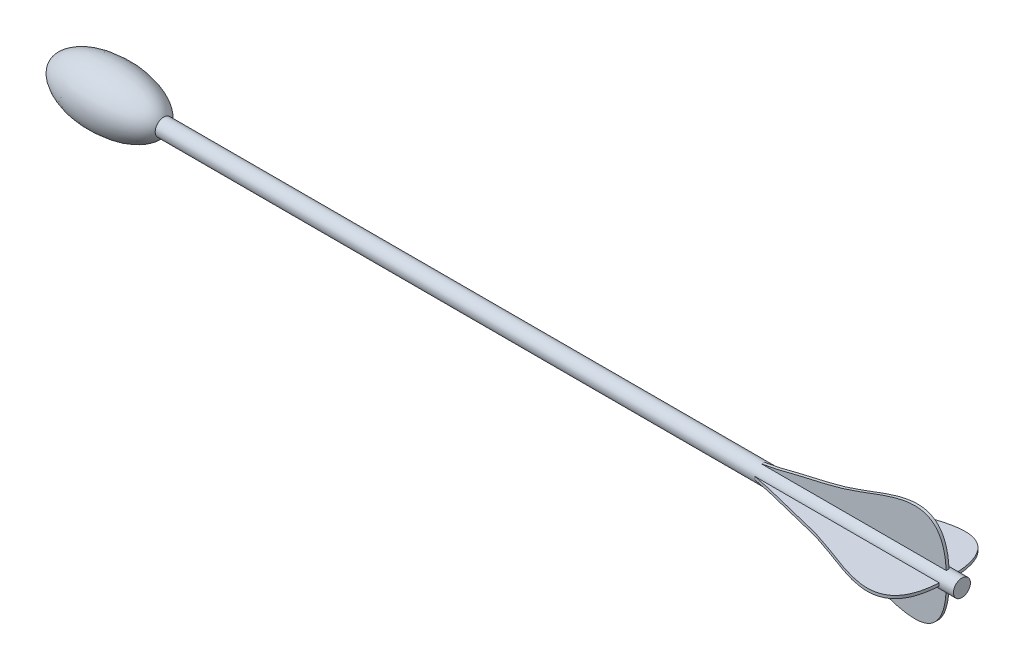
from build123d import *

# Parameters (mm, degrees)
BOSS_EXTRUDE1_REACH = 642.625
SKETCH2_R           = 6
BOSS_EXTRUDE2_START = -1
BOSS_EXTRUDE2_DEPTH = 2
CIRPATTERN1_COUNT   = 2
CIRPATTERN1_ANGLE   = 90


# Read off the part's stored shape, not the designer's step: Boss-Extrude2
with BuildPart() as part:
    # Sketch1 → Revolve1 (revolve)
    with BuildSketch(Plane(origin=(0, 0, 0), x_dir=(1, 0, 0), z_dir=(0, 1, 0))):
        with BuildLine():
            Line((-40, 0), (40, 0))
            add(Edge.make_bspline(
                [(-40, 0), (-40, -20), (0, -20), (40, -20), (40, 0)],
                knots=[3.141592654, 3.141592654, 3.141592654, 4.71238898, 4.71238898, 6.283185307, 6.283185307, 6.283185307], degree=2, weights=[1, 0.707106781, 1, 0.707106781, 1]))
        make_face()
    revolve(axis=Axis((-40, 0, 0), (1, 0, 0)))

    # Sketch2 → Boss-Extrude1 (add, up to next)
    with BuildSketch(Plane(origin=(600, 0, 0), x_dir=(0, 0, -1), z_dir=(1, 0, 0)), mode=Mode.PRIVATE) as boss_extrude1_sk1:
        Circle(SKETCH2_R)
    boss_extrude1_tool1 = extrude(boss_extrude1_sk1.sketch, amount=-BOSS_EXTRUDE1_REACH, mode=Mode.PRIVATE) - part.part
    add(boss_extrude1_tool1.solids().sort_by_distance((600, 0, 0))[0])


with BuildPart() as body_2:
    # Boss-Extrude2 outline → Boss-Extrude2 (new body)
    with BuildSketch(Plane(origin=(0, 0, 0), x_dir=(1, 0, 0), z_dir=(0, 1, 0)).offset(BOSS_EXTRUDE2_START)):
        with BuildLine():
            Line((590, -6), (460, -6))
            add(Edge.make_bspline(
                [(460, -6), (487.39194151, -10.48125039), (489.808113242, -15.374560028), (520.965779305, -22.647398554), (513.784202435, 0.952711564), (585.929324234, -77.930789309), (590, -6)],
                knots=[0, 0, 0, 0, 0, 0, 0, 1, 1, 1, 1, 1, 1, 1], degree=6))
        make_face()
        with BuildLine():
            Line((460, 6), (590, 6))
            add(Edge.make_bspline(
                [(590, 6), (585.929324234, 77.930789309), (513.784202435, -0.952711564), (520.965779305, 22.647398554), (489.808113242, 15.374560028), (487.39194151, 10.48125039), (460, 6)],
                knots=[0, 0, 0, 0, 0, 0, 0, 1, 1, 1, 1, 1, 1, 1], degree=6))
        make_face()
    extrude(amount=BOSS_EXTRUDE2_DEPTH)


with BuildPart() as cirpattern1_1:
    # CirPattern1: pattern copy
    add(body_2.part.rotate(Axis((-40.002, 0, 0), (1, 0, 0)), 1 * CIRPATTERN1_ANGLE / (CIRPATTERN1_COUNT - 1)))


solid = Compound([part.part, body_2.part, cirpattern1_1.part])
